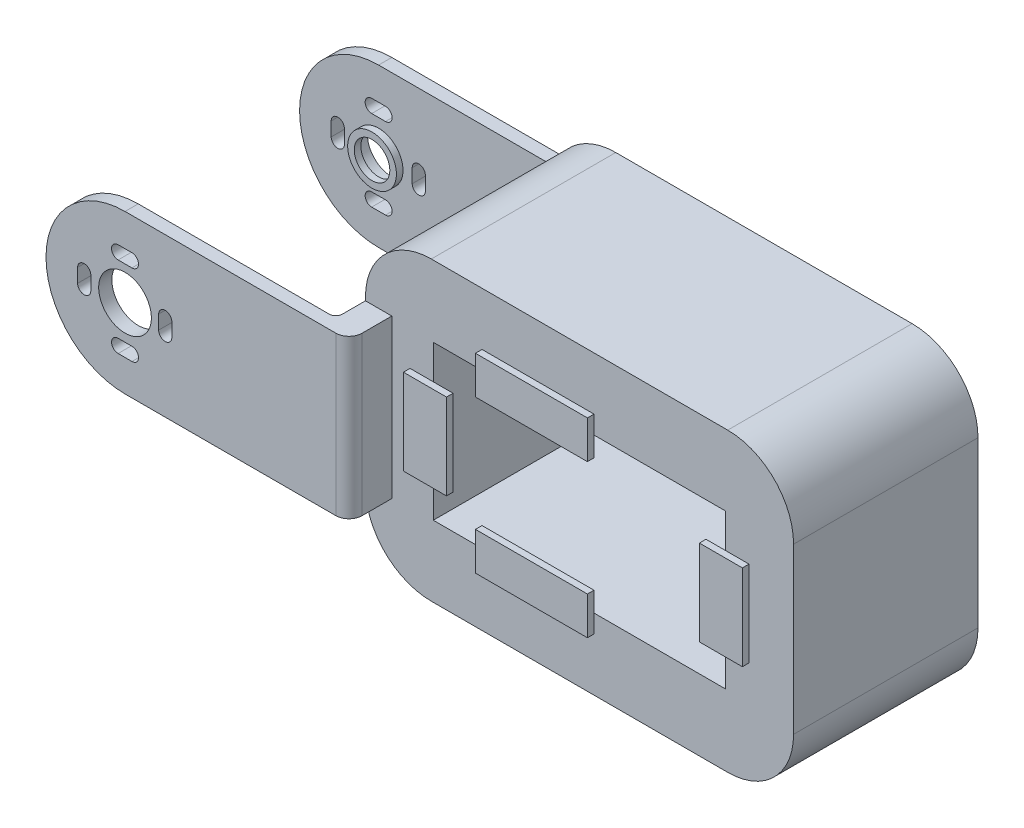
from build123d import *

# Parameters (mm, degrees)
SKETCH_1_W             = 65
SKETCH_1_H             = 45
EXTRUDE_1_DEPTH        = 28
SKETCH_2_W             = 44.4
SKETCH_2_H             = 23.4
CUT_EXTRUDE_1_DEPTH    = 39
SKETCH_3_W             = 4
SKETCH_3_H             = 24
EXTRUDE_2_DEPTH        = 6
EXTRUDE_START          = -0.5
SKETCH_7_R             = 4
EXTRUDE_3_DEPTH        = 2
SKETCH_8_W             = 4
SKETCH_8_H             = 24
EXTRUDE_4_DEPTH        = 6
FILLET_1_R             = 10
FILLET_2_R             = 10
FILLET_3_R             = 10
FILLET_4_R             = 10
PATTERN_LINEAR_2_COUNT = 2
PATTERN_LINEAR_2_PITCH = 38.5
FILLET_5_R             = 2
SKETCH_9_R             = 3.7
SKETCH_9_R_2           = 2.7
EXTRUDE_5_DEPTH        = 1
EXTRUDE_6_DEPTH        = 1
EXTRUDE_6_2_DEPTH      = 1
EXTRUDE_6_3_DEPTH      = 1
SKETCH_10_W            = 17
SKETCH_10_H            = 5.754584259
EXTRUDE_6_4_DEPTH      = 1
EXTRUDE_START_2        = 2
SKETCH_12_R            = 4
SKETCH_12_R_2          = 3.7
EXTRUDE_8_DEPTH        = 2
SKETCH_15_W            = 4
SKETCH_15_H            = 24
EXTRUDE_10_DEPTH       = 0.5
FILLET_16_R            = 2
FILLET_17_R            = 1
FILLET_18_R            = 1


with BuildPart() as part:
    # 草圖1 → 填料-伸長1 (new body)
    with BuildSketch(Plane.XY):
        with Locations((-27.434655272, 0)):
            Rectangle(SKETCH_1_W, SKETCH_1_H)
    extrude(amount=EXTRUDE_1_DEPTH)

    # 草圖2 → 除料-伸長1 (cut)
    with BuildSketch(Plane.XY):
        with Locations((-27.434655272, 0)):
            Rectangle(SKETCH_2_W, SKETCH_2_H)
    extrude(amount=CUT_EXTRUDE_1_DEPTH, mode=Mode.SUBTRACT)

    # 草圖3 → 填料-伸長2 (add)
    with BuildSketch(Plane.XY.offset(28)):
        with Locations((-57.934655272, 0)):
            Rectangle(SKETCH_3_W, SKETCH_3_H)
    extrude(amount=EXTRUDE_2_DEPTH)

    # 草圖7 → 填料-伸長3 (add)
    with BuildSketch(Plane.XY.offset(33).offset(EXTRUDE_START)):
        with BuildLine():
            Line((-59.934655272, 12), (-59.934655272, -12))
            Line((-59.934655272, -12), (-89.934655272, -12))
            ThreePointArc((-89.934655272, -12), (-101.934655272, 0), (-89.934655272, 12))
            Line((-89.934655272, 12), (-59.934655272, 12))
        make_face()
        with Locations((-89.934655272, 0)):
            Circle(SKETCH_7_R, mode=Mode.SUBTRACT)
        with BuildLine():
            Line((-95.134655272, 1.05), (-95.134655272, -1.05))
            ThreePointArc((-95.134655272, -1.05), (-96.134655272, -2.05), (-97.134655272, -1.05))
            Line((-97.134655272, -1.05), (-97.134655272, 1.05))
            ThreePointArc((-97.134655272, 1.05), (-96.134655272, 2.05), (-95.134655272, 1.05))
        make_face(mode=Mode.SUBTRACT)
        with BuildLine():
            Line((-90.984655272, -5.2), (-88.884655272, -5.2))
            ThreePointArc((-88.884655272, -5.2), (-87.884655272, -6.2), (-88.884655272, -7.2))
            Line((-88.884655272, -7.2), (-90.984655272, -7.2))
            ThreePointArc((-90.984655272, -7.2), (-91.984655272, -6.2), (-90.984655272, -5.2))
        make_face(mode=Mode.SUBTRACT)
        with BuildLine():
            Line((-90.984655272, 5.1), (-88.884655272, 5.1))
            ThreePointArc((-88.884655272, 5.1), (-87.884655272, 6.1), (-88.884655272, 7.1))
            Line((-88.884655272, 7.1), (-90.984655272, 7.1))
            ThreePointArc((-90.984655272, 7.1), (-91.984655272, 6.1), (-90.984655272, 5.1))
        make_face(mode=Mode.SUBTRACT)
        with BuildLine():
            Line((-84.834655272, 1.05), (-84.834655272, -1.05))
            ThreePointArc((-84.834655272, -1.05), (-83.834655272, -2.05), (-82.834655272, -1.05))
            Line((-82.834655272, -1.05), (-82.834655272, 1.05))
            ThreePointArc((-82.834655272, 1.05), (-83.834655272, 2.05), (-84.834655272, 1.05))
        make_face(mode=Mode.SUBTRACT)
    extrude_3 = extrude(amount=EXTRUDE_3_DEPTH)

    # 草圖8 → 填料-伸長4 (add)
    with BuildSketch(Plane(origin=(0, 0, 0), x_dir=(-1, 0, 0), z_dir=(0, 0, -1))):
        with Locations((57.934655272, 0)):
            Rectangle(SKETCH_8_W, SKETCH_8_H)
    extrude(amount=EXTRUDE_4_DEPTH)

    # 圓角1
    fillet_1_edges = [part.edges().sort_by_distance(p)[0] for p in [
        (-59.934655272, -22.5, 14),
    ]]
    fillet(fillet_1_edges, radius=FILLET_1_R)

    # 圓角2
    fillet_2_edges = [part.edges().sort_by_distance(p)[0] for p in [
        (-59.934655272, 22.5, 14),
    ]]
    fillet(fillet_2_edges, radius=FILLET_2_R)

    # 圓角3
    fillet_3_edges = [part.edges().sort_by_distance(p)[0] for p in [
        (5.065344728, 22.5, 14),
    ]]
    fillet(fillet_3_edges, radius=FILLET_3_R)

    # 圓角4
    fillet_4_edges = [part.edges().sort_by_distance(p)[0] for p in [
        (5.065344728, -22.5, 14),
    ]]
    fillet(fillet_4_edges, radius=FILLET_4_R)

    # 直線複製排列2: 填料-伸長3 ×2
    with Locations(*[(0, 0, -i * PATTERN_LINEAR_2_PITCH) for i in range(1, PATTERN_LINEAR_2_COUNT)]):
        add(extrude_3)

    # 圓角5
    fillet_5_edges = [part.edges().sort_by_distance(p)[0] for p in [
        (-55.934655272, 0, -6),
    ]]
    fillet(fillet_5_edges, radius=FILLET_5_R)

    # 草圖12 → 填料-伸長8 (add)
    with BuildSketch(Plane(origin=(0, 0, -4), x_dir=(-1, 0, 0), z_dir=(0, 0, -1)).offset(EXTRUDE_START_2)):
        with Locations((89.934655272, 0)):
            Circle(SKETCH_12_R)
        with Locations((89.934655272, 0)):
            Circle(SKETCH_12_R_2, mode=Mode.SUBTRACT)
    extrude(amount=-EXTRUDE_8_DEPTH)

    # 草圖15 → 填料-伸長10 (add)
    with BuildSketch(Plane.XY.offset(34)):
        with Locations((-57.934655272, 0)):
            Rectangle(SKETCH_15_W, SKETCH_15_H)
    extrude(amount=EXTRUDE_10_DEPTH)

    # 圓角16
    fillet_16_edges = [part.edges().sort_by_distance(p)[0] for p in [
        (-55.934655272, 0, 34.5),
    ]]
    fillet(fillet_16_edges, radius=FILLET_16_R)

    # 圓角17
    fillet_17_edges = [part.edges().sort_by_distance(p)[0] for p in [
        (-59.934655272, 0, 32.5),
    ]]
    fillet(fillet_17_edges, radius=FILLET_17_R)

    # 圓角18
    fillet_18_edges = [part.edges().sort_by_distance(p)[0] for p in [
        (-59.934655272, 0, -4),
    ]]
    fillet(fillet_18_edges, radius=FILLET_18_R)


with BuildPart() as body_2:
    # 草圖9 → 填料-伸長5 (new body)
    with BuildSketch(Plane.XY.offset(-4)):
        with Locations((-89.934655272, 0)):
            Circle(SKETCH_9_R)
        with Locations((-89.934655272, 0)):
            Circle(SKETCH_9_R_2, mode=Mode.SUBTRACT)
    extrude(amount=EXTRUDE_5_DEPTH)


with BuildPart() as body_3:
    # 草圖10 → 填料-伸長6 (new body)
    with BuildSketch(Plane.XY.offset(29)):
        Polygon((-49.634655272, 6.5), (-53.165057103, 6.5), (-53.165057103, -6.5), (-46.634655272, -6.5), (-46.634655272, 6.5), align=None)
    extrude(amount=-EXTRUDE_6_DEPTH)


with BuildPart() as body_4:
    # 草圖10 → Extrude 6 2 (new body)
    with BuildSketch(Plane.XY.offset(29)):
        Polygon((-42.234655272, -11.7), (-42.234655272, -8.7), (-25.234655272, -8.7), (-25.234655272, -14.454584259), (-42.234655272, -14.454584259), align=None)
    extrude(amount=-EXTRUDE_6_2_DEPTH)


with BuildPart() as body_5:
    # 草圖10 → Extrude 6 3 (new body)
    with BuildSketch(Plane.XY.offset(29)):
        Polygon((-8.234655272, 6.5), (-8.234655272, -6.5), (-5.234655272, -6.5), (-1.70425344, -6.5), (-1.70425344, 6.5), align=None)
    extrude(amount=-EXTRUDE_6_3_DEPTH)


with BuildPart() as body_6:
    # 草圖10 → Extrude 6 4 (new body)
    with BuildSketch(Plane.XY.offset(29)):
        with Locations((-33.734655272, 11.57729213)):
            Rectangle(SKETCH_10_W, SKETCH_10_H)
    extrude(amount=-EXTRUDE_6_4_DEPTH)


solid = Compound([part.part, body_2.part, body_3.part, body_4.part, body_5.part, body_6.part])
